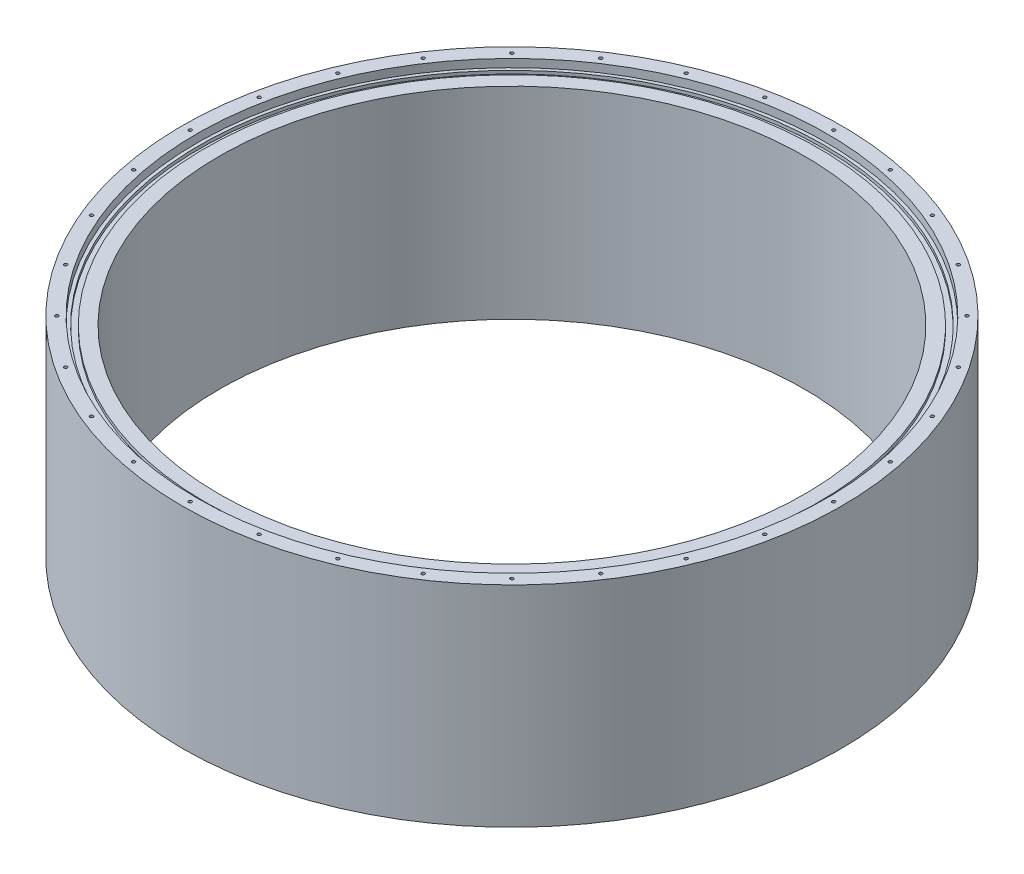
from build123d import *

# Parameters (mm, degrees)
SKETCH2_W                 = 4.1656
SKETCH2_H                 = 2.413
CIRPATTERN1_COUNT         = 32
F_5_0MM_DOWEL_HOLE1_D     = 5.05
F_5_0MM_DOWEL_HOLE1_DEPTH = 6
F_5_0MM_DOWEL_HOLE1_TIP   = 1.517173063


with BuildPart() as part:
    # Sketch1 → Revolve1 (revolve)
    with BuildSketch(Plane.XY):
        Polygon((225.6, 74.685), (243, 74.685), (243, 80.885), (254, 80.885), (254, -80.885), (225.6, -80.885), align=None)
    revolve(axis=Axis((0, 80.885, 0), (0, -1, 0)))

    # Sketch2 → Cut-Revolve1 (revolve, cut)
    with BuildSketch(Plane.XY):
        with Locations((238.4172, 73.4785)):
            Rectangle(SKETCH2_W, SKETCH2_H)
    revolve(axis=Axis((0, 80.885, 0), (0, -1, 0)), mode=Mode.SUBTRACT)

    # Sketch4 → M3x0.5 Tapped Hole1 (revolve, cut)
    with BuildSketch(Plane(origin=(248, 80.885, 0), x_dir=(0, 0, 1), z_dir=(1, 0, 0))):
        Polygon((0, 0), (0, 10.251075774), (1.25, 9.5), (1.25, 0), align=None)
    m3x0_5_tapped_hole1 = revolve(axis=Axis((248, 87.235, 0), (0, -1, 0)), mode=Mode.SUBTRACT)

    # CirPattern1: M3x0.5 Tapped Hole1 ×32 about axis
    cirpattern1_axis = Axis((0, 80.885, 0), (0, 1, 0))
    for i in range(1, CIRPATTERN1_COUNT):
        add(m3x0_5_tapped_hole1.rotate(cirpattern1_axis, i * 360 / CIRPATTERN1_COUNT), mode=Mode.SUBTRACT)

    # Mirror1 copy 1 sketch → Mirror1 copy 1 (revolve, cut)
    with BuildSketch(Plane(origin=(243.23474954, -80.885, -48.38239986), x_dir=(0.19509032201612825, 0, 0.9807852804032304), z_dir=(0.9807852804032304, 0, -0.19509032201612825))):
        Polygon((0, 0), (0, -10.251075774), (1.25, -9.5), (1.25, 0), align=None)
    revolve(axis=Axis((243.23474954, -87.235, -48.38239986), (0, -1, 0)), mode=Mode.SUBTRACT)

    # Mirror1 copy 2 sketch → Mirror1 copy 2 (revolve, cut)
    with BuildSketch(Plane(origin=(229.122124063, -80.885, -94.905491227), x_dir=(0.3826834323650898, 0, 0.9238795325112867), z_dir=(0.9238795325112867, 0, -0.3826834323650898))):
        Polygon((0, 0), (0, -10.251075774), (1.25, -9.5), (1.25, 0), align=None)
    revolve(axis=Axis((229.122124063, -87.235, -94.905491227), (0, -1, 0)), mode=Mode.SUBTRACT)

    # Mirror1 copy 3 sketch → Mirror1 copy 3 (revolve, cut)
    with BuildSketch(Plane(origin=(206.204463851, -80.885, -137.781417789), x_dir=(0.5555702330196022, 0, 0.8314696123025452), z_dir=(0.8314696123025452, 0, -0.5555702330196022))):
        Polygon((0, 0), (0, -10.251075774), (1.25, -9.5), (1.25, 0), align=None)
    revolve(axis=Axis((206.204463851, -87.235, -137.781417789), (0, -1, 0)), mode=Mode.SUBTRACT)

    # Mirror1 copy 4 sketch → Mirror1 copy 4 (revolve, cut)
    with BuildSketch(Plane(origin=(175.362481734, -80.885, -175.362481734), x_dir=(0.7071067811865475, 0, 0.7071067811865476), z_dir=(0.7071067811865476, 0, -0.7071067811865475))):
        Polygon((0, 0), (0, -10.251075774), (1.25, -9.5), (1.25, 0), align=None)
    revolve(axis=Axis((175.362481734, -87.235, -175.362481734), (0, -1, 0)), mode=Mode.SUBTRACT)

    # Mirror1 copy 5 sketch → Mirror1 copy 5 (revolve, cut)
    with BuildSketch(Plane(origin=(137.781417789, -80.885, -206.204463851), x_dir=(0.8314696123025452, 0, 0.5555702330196023), z_dir=(0.5555702330196023, 0, -0.8314696123025452))):
        Polygon((0, 0), (0, -10.251075774), (1.25, -9.5), (1.25, 0), align=None)
    revolve(axis=Axis((137.781417789, -87.235, -206.204463851), (0, -1, 0)), mode=Mode.SUBTRACT)

    # Mirror1 copy 6 sketch → Mirror1 copy 6 (revolve, cut)
    with BuildSketch(Plane(origin=(94.905491227, -80.885, -229.122124063), x_dir=(0.9238795325112867, 0, 0.38268343236508984), z_dir=(0.38268343236508984, 0, -0.9238795325112867))):
        Polygon((0, 0), (0, -10.251075774), (1.25, -9.5), (1.25, 0), align=None)
    revolve(axis=Axis((94.905491227, -87.235, -229.122124063), (0, -1, 0)), mode=Mode.SUBTRACT)

    # Mirror1 copy 7 sketch → Mirror1 copy 7 (revolve, cut)
    with BuildSketch(Plane(origin=(48.38239986, -80.885, -243.23474954), x_dir=(0.9807852804032304, 0, 0.19509032201612833), z_dir=(0.19509032201612833, 0, -0.9807852804032304))):
        Polygon((0, 0), (0, -10.251075774), (1.25, -9.5), (1.25, 0), align=None)
    revolve(axis=Axis((48.38239986, -87.235, -243.23474954), (0, -1, 0)), mode=Mode.SUBTRACT)

    # Mirror1 copy 8 sketch → Mirror1 copy 8 (revolve, cut)
    with BuildSketch(Plane(origin=(0, -80.885, -248), x_dir=(1, 0, 0), z_dir=(0, 0, -1))):
        Polygon((0, 0), (0, -10.251075774), (1.25, -9.5), (1.25, 0), align=None)
    revolve(axis=Axis((0, -87.235, -248), (0, -1, 0)), mode=Mode.SUBTRACT)

    # Mirror1 copy 9 sketch → Mirror1 copy 9 (revolve, cut)
    with BuildSketch(Plane(origin=(-48.38239986, -80.885, -243.23474954), x_dir=(0.9807852804032304, 0, -0.1950903220161282), z_dir=(-0.1950903220161282, 0, -0.9807852804032304))):
        Polygon((0, 0), (0, -10.251075774), (1.25, -9.5), (1.25, 0), align=None)
    revolve(axis=Axis((-48.38239986, -87.235, -243.23474954), (0, -1, 0)), mode=Mode.SUBTRACT)

    # Mirror1 copy 10 sketch → Mirror1 copy 10 (revolve, cut)
    with BuildSketch(Plane(origin=(-94.905491227, -80.885, -229.122124063), x_dir=(0.9238795325112867, 0, -0.3826834323650897), z_dir=(-0.3826834323650897, 0, -0.9238795325112867))):
        Polygon((0, 0), (0, -10.251075774), (1.25, -9.5), (1.25, 0), align=None)
    revolve(axis=Axis((-94.905491227, -87.235, -229.122124063), (0, -1, 0)), mode=Mode.SUBTRACT)

    # Mirror1 copy 11 sketch → Mirror1 copy 11 (revolve, cut)
    with BuildSketch(Plane(origin=(-137.781417789, -80.885, -206.204463851), x_dir=(0.8314696123025451, 0, -0.5555702330196023), z_dir=(-0.5555702330196023, 0, -0.8314696123025451))):
        Polygon((0, 0), (0, -10.251075774), (1.25, -9.5), (1.25, 0), align=None)
    revolve(axis=Axis((-137.781417789, -87.235, -206.204463851), (0, -1, 0)), mode=Mode.SUBTRACT)

    # Mirror1 copy 12 sketch → Mirror1 copy 12 (revolve, cut)
    with BuildSketch(Plane(origin=(-175.362481734, -80.885, -175.362481734), x_dir=(0.7071067811865476, 0, -0.7071067811865475), z_dir=(-0.7071067811865475, 0, -0.7071067811865476))):
        Polygon((0, 0), (0, -10.251075774), (1.25, -9.5), (1.25, 0), align=None)
    revolve(axis=Axis((-175.362481734, -87.235, -175.362481734), (0, -1, 0)), mode=Mode.SUBTRACT)

    # Mirror1 copy 13 sketch → Mirror1 copy 13 (revolve, cut)
    with BuildSketch(Plane(origin=(-206.204463851, -80.885, -137.781417789), x_dir=(0.5555702330196022, 0, -0.8314696123025453), z_dir=(-0.8314696123025453, 0, -0.5555702330196022))):
        Polygon((0, 0), (0, -10.251075774), (1.25, -9.5), (1.25, 0), align=None)
    revolve(axis=Axis((-206.204463851, -87.235, -137.781417789), (0, -1, 0)), mode=Mode.SUBTRACT)

    # Mirror1 copy 14 sketch → Mirror1 copy 14 (revolve, cut)
    with BuildSketch(Plane(origin=(-229.122124063, -80.885, -94.905491227), x_dir=(0.3826834323650899, 0, -0.9238795325112867), z_dir=(-0.9238795325112867, 0, -0.3826834323650899))):
        Polygon((0, 0), (0, -10.251075774), (1.25, -9.5), (1.25, 0), align=None)
    revolve(axis=Axis((-229.122124063, -87.235, -94.905491227), (0, -1, 0)), mode=Mode.SUBTRACT)

    # Mirror1 copy 15 sketch → Mirror1 copy 15 (revolve, cut)
    with BuildSketch(Plane(origin=(-243.23474954, -80.885, -48.38239986), x_dir=(0.19509032201612816, 0, -0.9807852804032304), z_dir=(-0.9807852804032304, 0, -0.19509032201612816))):
        Polygon((0, 0), (0, -10.251075774), (1.25, -9.5), (1.25, 0), align=None)
    revolve(axis=Axis((-243.23474954, -87.235, -48.38239986), (0, -1, 0)), mode=Mode.SUBTRACT)

    # Mirror1 copy 16 sketch → Mirror1 copy 16 (revolve, cut)
    with BuildSketch(Plane(origin=(-248, -80.885, 0), x_dir=(0, 0, -1), z_dir=(-1, 0, 0))):
        Polygon((0, 0), (0, -10.251075774), (1.25, -9.5), (1.25, 0), align=None)
    revolve(axis=Axis((-248, -87.235, 0), (0, -1, 0)), mode=Mode.SUBTRACT)

    # Mirror1 copy 17 sketch → Mirror1 copy 17 (revolve, cut)
    with BuildSketch(Plane(origin=(-243.23474954, -80.885, 48.38239986), x_dir=(-0.19509032201612836, 0, -0.9807852804032304), z_dir=(-0.9807852804032304, 0, 0.19509032201612836))):
        Polygon((0, 0), (0, -10.251075774), (1.25, -9.5), (1.25, 0), align=None)
    revolve(axis=Axis((-243.23474954, -87.235, 48.38239986), (0, -1, 0)), mode=Mode.SUBTRACT)

    # Mirror1 copy 18 sketch → Mirror1 copy 18 (revolve, cut)
    with BuildSketch(Plane(origin=(-229.122124063, -80.885, 94.905491227), x_dir=(-0.38268343236508967, 0, -0.9238795325112868), z_dir=(-0.9238795325112868, 0, 0.38268343236508967))):
        Polygon((0, 0), (0, -10.251075774), (1.25, -9.5), (1.25, 0), align=None)
    revolve(axis=Axis((-229.122124063, -87.235, 94.905491227), (0, -1, 0)), mode=Mode.SUBTRACT)

    # Mirror1 copy 19 sketch → Mirror1 copy 19 (revolve, cut)
    with BuildSketch(Plane(origin=(-206.204463851, -80.885, 137.781417789), x_dir=(-0.5555702330196023, 0, -0.8314696123025452), z_dir=(-0.8314696123025452, 0, 0.5555702330196023))):
        Polygon((0, 0), (0, -10.251075774), (1.25, -9.5), (1.25, 0), align=None)
    revolve(axis=Axis((-206.204463851, -87.235, 137.781417789), (0, -1, 0)), mode=Mode.SUBTRACT)

    # Mirror1 copy 20 sketch → Mirror1 copy 20 (revolve, cut)
    with BuildSketch(Plane(origin=(-175.362481734, -80.885, 175.362481734), x_dir=(-0.7071067811865475, 0, -0.7071067811865477), z_dir=(-0.7071067811865477, 0, 0.7071067811865475))):
        Polygon((0, 0), (0, -10.251075774), (1.25, -9.5), (1.25, 0), align=None)
    revolve(axis=Axis((-175.362481734, -87.235, 175.362481734), (0, -1, 0)), mode=Mode.SUBTRACT)

    # Mirror1 copy 21 sketch → Mirror1 copy 21 (revolve, cut)
    with BuildSketch(Plane(origin=(-137.781417789, -80.885, 206.204463851), x_dir=(-0.8314696123025452, 0, -0.5555702330196022), z_dir=(-0.5555702330196022, 0, 0.8314696123025452))):
        Polygon((0, 0), (0, -10.251075774), (1.25, -9.5), (1.25, 0), align=None)
    revolve(axis=Axis((-137.781417789, -87.235, 206.204463851), (0, -1, 0)), mode=Mode.SUBTRACT)

    # Mirror1 copy 22 sketch → Mirror1 copy 22 (revolve, cut)
    with BuildSketch(Plane(origin=(-94.905491227, -80.885, 229.122124063), x_dir=(-0.9238795325112868, 0, -0.3826834323650895), z_dir=(-0.3826834323650895, 0, 0.9238795325112868))):
        Polygon((0, 0), (0, -10.251075774), (1.25, -9.5), (1.25, 0), align=None)
    revolve(axis=Axis((-94.905491227, -87.235, 229.122124063), (0, -1, 0)), mode=Mode.SUBTRACT)

    # Mirror1 copy 23 sketch → Mirror1 copy 23 (revolve, cut)
    with BuildSketch(Plane(origin=(-48.38239986, -80.885, 243.23474954), x_dir=(-0.9807852804032303, 0, -0.19509032201612866), z_dir=(-0.19509032201612866, 0, 0.9807852804032303))):
        Polygon((0, 0), (0, -10.251075774), (1.25, -9.5), (1.25, 0), align=None)
    revolve(axis=Axis((-48.38239986, -87.235, 243.23474954), (0, -1, 0)), mode=Mode.SUBTRACT)

    # Mirror1 copy 24 sketch → Mirror1 copy 24 (revolve, cut)
    with BuildSketch(Plane(origin=(0, -80.885, 248), x_dir=(-1, 0, 0), z_dir=(0, 0, 1))):
        Polygon((0, 0), (0, -10.251075774), (1.25, -9.5), (1.25, 0), align=None)
    revolve(axis=Axis((0, -87.235, 248), (0, -1, 0)), mode=Mode.SUBTRACT)

    # Mirror1 copy 25 sketch → Mirror1 copy 25 (revolve, cut)
    with BuildSketch(Plane(origin=(48.38239986, -80.885, 243.23474954), x_dir=(-0.9807852804032304, 0, 0.1950903220161283), z_dir=(0.1950903220161283, 0, 0.9807852804032304))):
        Polygon((0, 0), (0, -10.251075774), (1.25, -9.5), (1.25, 0), align=None)
    revolve(axis=Axis((48.38239986, -87.235, 243.23474954), (0, -1, 0)), mode=Mode.SUBTRACT)

    # Mirror1 copy 26 sketch → Mirror1 copy 26 (revolve, cut)
    with BuildSketch(Plane(origin=(94.905491227, -80.885, 229.122124063), x_dir=(-0.9238795325112866, 0, 0.38268343236509), z_dir=(0.38268343236509, 0, 0.9238795325112866))):
        Polygon((0, 0), (0, -10.251075774), (1.25, -9.5), (1.25, 0), align=None)
    revolve(axis=Axis((94.905491227, -87.235, 229.122124063), (0, -1, 0)), mode=Mode.SUBTRACT)

    # Mirror1 copy 27 sketch → Mirror1 copy 27 (revolve, cut)
    with BuildSketch(Plane(origin=(137.781417789, -80.885, 206.204463851), x_dir=(-0.8314696123025455, 0, 0.5555702330196018), z_dir=(0.5555702330196018, 0, 0.8314696123025455))):
        Polygon((0, 0), (0, -10.251075774), (1.25, -9.5), (1.25, 0), align=None)
    revolve(axis=Axis((137.781417789, -87.235, 206.204463851), (0, -1, 0)), mode=Mode.SUBTRACT)

    # Mirror1 copy 28 sketch → Mirror1 copy 28 (revolve, cut)
    with BuildSketch(Plane(origin=(175.362481734, -80.885, 175.362481734), x_dir=(-0.7071067811865477, 0, 0.7071067811865474), z_dir=(0.7071067811865474, 0, 0.7071067811865477))):
        Polygon((0, 0), (0, -10.251075774), (1.25, -9.5), (1.25, 0), align=None)
    revolve(axis=Axis((175.362481734, -87.235, 175.362481734), (0, -1, 0)), mode=Mode.SUBTRACT)

    # Mirror1 copy 29 sketch → Mirror1 copy 29 (revolve, cut)
    with BuildSketch(Plane(origin=(206.204463851, -80.885, 137.781417789), x_dir=(-0.5555702330196022, 0, 0.8314696123025452), z_dir=(0.8314696123025452, 0, 0.5555702330196022))):
        Polygon((0, 0), (0, -10.251075774), (1.25, -9.5), (1.25, 0), align=None)
    revolve(axis=Axis((206.204463851, -87.235, 137.781417789), (0, -1, 0)), mode=Mode.SUBTRACT)

    # Mirror1 copy 30 sketch → Mirror1 copy 30 (revolve, cut)
    with BuildSketch(Plane(origin=(229.122124063, -80.885, 94.905491227), x_dir=(-0.38268343236508956, 0, 0.9238795325112868), z_dir=(0.9238795325112868, 0, 0.38268343236508956))):
        Polygon((0, 0), (0, -10.251075774), (1.25, -9.5), (1.25, 0), align=None)
    revolve(axis=Axis((229.122124063, -87.235, 94.905491227), (0, -1, 0)), mode=Mode.SUBTRACT)

    # Mirror1 copy 31 sketch → Mirror1 copy 31 (revolve, cut)
    with BuildSketch(Plane(origin=(243.23474954, -80.885, 48.38239986), x_dir=(-0.19509032201612872, 0, 0.9807852804032303), z_dir=(0.9807852804032303, 0, 0.19509032201612872))):
        Polygon((0, 0), (0, -10.251075774), (1.25, -9.5), (1.25, 0), align=None)
    revolve(axis=Axis((243.23474954, -87.235, 48.38239986), (0, -1, 0)), mode=Mode.SUBTRACT)

    # Mirror1 copy 32 sketch → Mirror1 copy 32 (revolve, cut)
    with BuildSketch(Plane(origin=(248, -80.885, 0), x_dir=(0, 0, 1), z_dir=(1, 0, 0))):
        Polygon((0, 0), (0, -10.251075774), (1.25, -9.5), (1.25, 0), align=None)
    revolve(axis=Axis((248, -87.235, 0), (0, -1, 0)), mode=Mode.SUBTRACT)

    # Ø5.0mm Dowel Hole1
    with Locations(Plane(origin=(0, -80.885, 0), x_dir=(-1, 0, 0), z_dir=(0, -1, 0))):
        with Locations((24.210233661, -245.810627488), (-24.210233661, 245.810627488)):
            Hole(F_5_0MM_DOWEL_HOLE1_D / 2, depth=F_5_0MM_DOWEL_HOLE1_DEPTH)
            with Locations((0, 0, -(F_5_0MM_DOWEL_HOLE1_DEPTH + F_5_0MM_DOWEL_HOLE1_TIP / 2))):  # 118° drill point
                Cone(0, F_5_0MM_DOWEL_HOLE1_D / 2, F_5_0MM_DOWEL_HOLE1_TIP, mode=Mode.SUBTRACT)


solid = part.part
